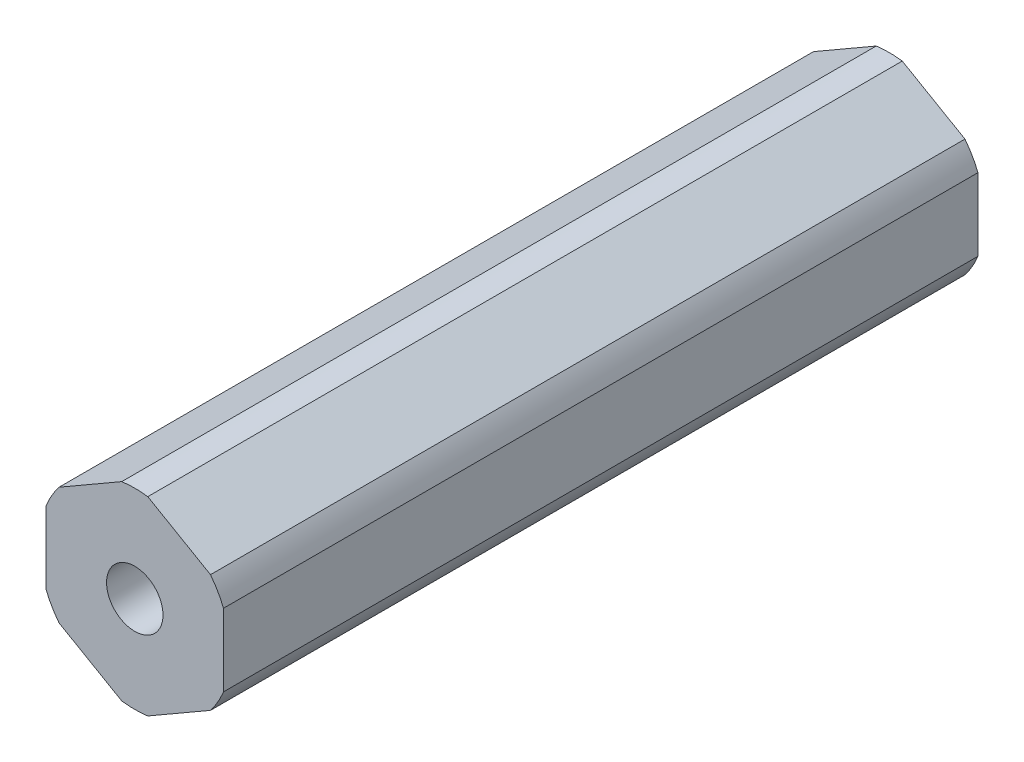
from build123d import *

# Parameters (mm, degrees)
BOSS_EXTRUDE1_DEPTH = 26.9875
SKETCH2_R           = 2.0193
CUT_EXTRUDE1_DEPTH  = 55.778237367


with BuildPart() as part:
    # Sketch1 → Boss-Extrude1 (new, symmetric)
    with BuildSketch(Plane.XY):
        with BuildLine():
            ThreePointArc((0.93173274, 6.79441227), (0, 6.858), (-0.93173274, 6.79441227))
            Line((-0.93173274, 6.79441227), (-5.41826726, 4.204110358))
            ThreePointArc((-5.41826726, 4.204110358), (-5.939202219, 3.429), (-6.35, 2.590301913))
            Line((-6.35, 2.590301913), (-6.35, -2.590301913))
            ThreePointArc((-6.35, -2.590301913), (-5.939202219, -3.429), (-5.41826726, -4.204110358))
            Line((-5.41826726, -4.204110358), (-0.93173274, -6.79441227))
            ThreePointArc((-0.93173274, -6.79441227), (0, -6.858), (0.93173274, -6.79441227))
            Line((0.93173274, -6.79441227), (5.41826726, -4.204110358))
            ThreePointArc((5.41826726, -4.204110358), (5.939202219, -3.429), (6.35, -2.590301913))
            Line((6.35, -2.590301913), (6.35, 2.590301913))
            ThreePointArc((6.35, 2.590301913), (5.939202219, 3.429), (5.41826726, 4.204110358))
            Line((5.41826726, 4.204110358), (0.93173274, 6.79441227))
        make_face()
    extrude(amount=BOSS_EXTRUDE1_DEPTH, both=True)

    # Sketch2 → Cut-Extrude1 (cut, through all)
    with BuildSketch(Plane.XY.offset(26.9875)):
        Circle(SKETCH2_R)
    extrude(amount=-CUT_EXTRUDE1_DEPTH, mode=Mode.SUBTRACT)


solid = part.part
